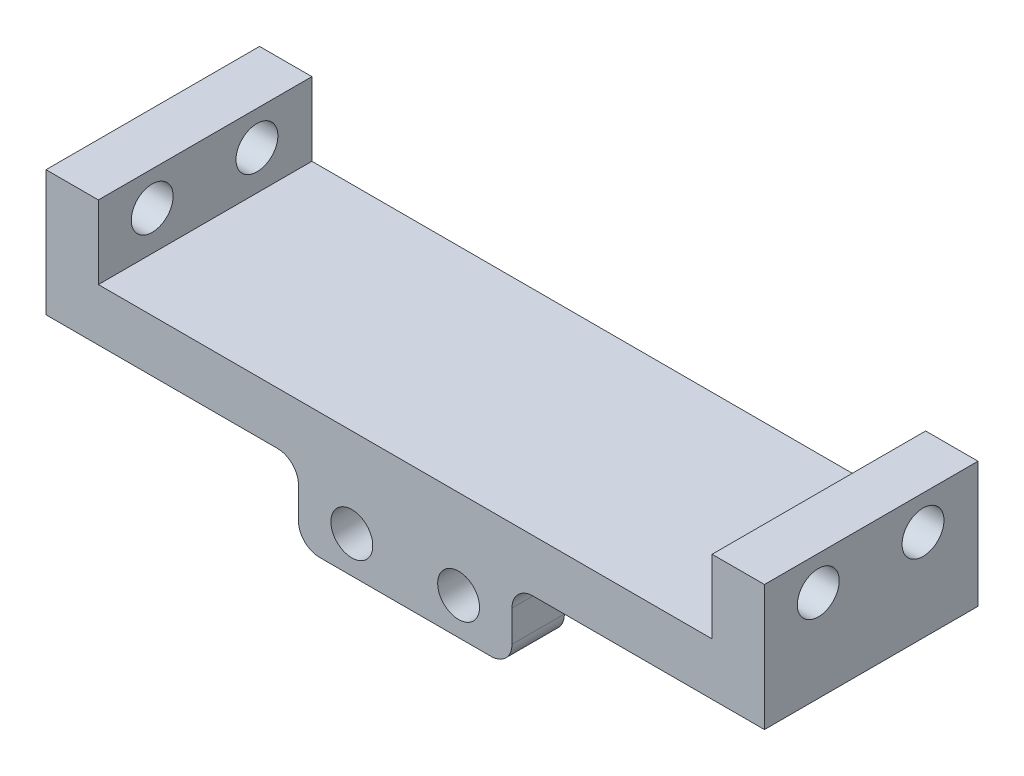
from build123d import *

# Parameters (mm, degrees)
SKETCH1_W                  = 68.6
SKETCH1_H                  = 20.38979341
BRACKETBASE_DEPTH          = 5
SKETCH2_W                  = 20.38979341
SKETCH2_H                  = 12
LEGMOUNTINGTAB_DEPTH       = 5
SKETCH3_R                  = 2
LEGMOUNTINGHOLES_DEPTH     = 5
SKETCH4_W                  = 20.38979341
SKETCH4_H                  = 7
ARDUINOMOUNTINGTAB_DEPTH   = 5
SKETCH5_R                  = 2
ARDUINOMOUNTINGHOLES_DEPTH = 5
FILLET1_R                  = 2


with BuildPart() as part:
    # Sketch1 → bracketBase (new body)
    with BuildSketch(Plane(origin=(0, 0, 0), x_dir=(1, 0, 0), z_dir=(0, 1, 0))):
        with Locations((34.3, 10.194896705)):
            Rectangle(SKETCH1_W, SKETCH1_H)
    extrude(amount=BRACKETBASE_DEPTH)

    # Sketch2 → legMountingTab (add)
    with BuildSketch(Plane.ZY):
        with Locations((-10.194896705, 6)):
            Rectangle(SKETCH2_W, SKETCH2_H)
    legmountingtab = extrude(amount=-LEGMOUNTINGTAB_DEPTH)

    # Sketch3 → legMountingHoles (cut)
    with BuildSketch(Plane(origin=(5, 0, 0), x_dir=(0, 0, -1), z_dir=(1, 0, 0))):
        with Locations((15.13979341, 8.75)):
            Circle(SKETCH3_R)
        with Locations((5.13979341, 8.75)):
            Circle(SKETCH3_R)
    legmountingholes = extrude(amount=-LEGMOUNTINGHOLES_DEPTH, mode=Mode.SUBTRACT)

    # legMountingHoles2: legMountingTab, legMountingHoles across plane
    add(legmountingtab.mirror(Plane.ZY.offset(-34.3)))
    add(legmountingholes.mirror(Plane.ZY.offset(-34.3)), mode=Mode.SUBTRACT)

    # Sketch4 → arduinoMountingTab (add)
    with BuildSketch(Plane.XY):
        with Locations((34.3, -3.5)):
            Rectangle(SKETCH4_W, SKETCH4_H)
    extrude(amount=-ARDUINOMOUNTINGTAB_DEPTH)

    # Sketch5 → arduinoMountingHoles (cut)
    with BuildSketch(Plane.XY):
        with Locations((39.397448352, -3.5)):
            Circle(SKETCH5_R)
        with Locations((29.202551647, -3.5)):
            Circle(SKETCH5_R)
    extrude(amount=-ARDUINOMOUNTINGHOLES_DEPTH, mode=Mode.SUBTRACT)

    # Fillet1
    fillet1_edges = [part.edges().sort_by_distance(p)[0] for p in [
        (24.105103295, -7, -2.5),
        (44.494896705, -7, -2.5),
        (44.494896705, 0, -2.5),
        (24.105103295, 0, -2.5),
    ]]
    fillet(fillet1_edges, radius=FILLET1_R)


solid = part.part
